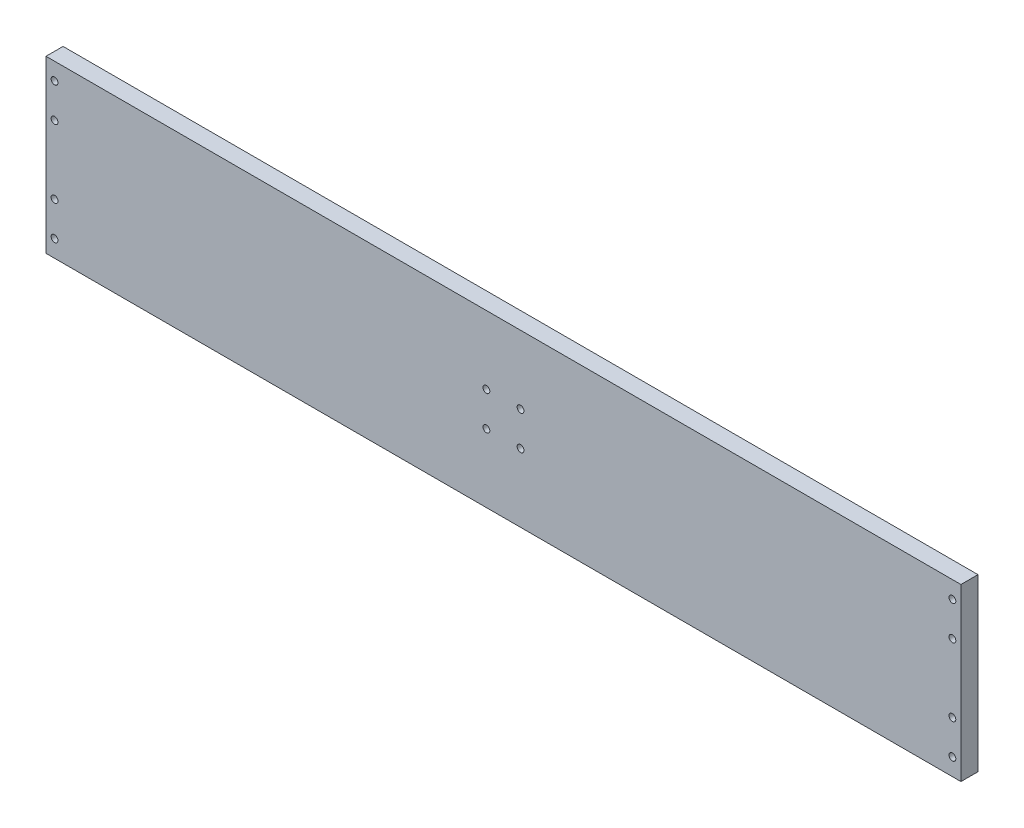
from build123d import *

# Parameters (mm, degrees)
SCHIZZO1_W                   = 536
SCHIZZO1_H                   = 100
SCHIZZO1_R                   = 2
ESTRUSIONE_ESTRUSIONE1_DEPTH = 10
SCHIZZO2_R                   = 2
TAGLIO_ESTRUSIONE1_DEPTH     = 546.340260755


with BuildPart() as part:
    # Schizzo1 → Estrusione-Estrusione1 (new body)
    with BuildSketch(Plane.XY):
        with Locations((268, 50)):
            Rectangle(SCHIZZO1_W, SCHIZZO1_H)
        with Locations((5, 90)):
            Circle(SCHIZZO1_R, mode=Mode.SUBTRACT)
        with Locations((5, 70)):
            Circle(SCHIZZO1_R, mode=Mode.SUBTRACT)
        with Locations((5, 30)):
            Circle(SCHIZZO1_R, mode=Mode.SUBTRACT)
        with Locations((531, 10)):
            Circle(SCHIZZO1_R, mode=Mode.SUBTRACT)
        with Locations((531, 30)):
            Circle(SCHIZZO1_R, mode=Mode.SUBTRACT)
        with Locations((531, 70)):
            Circle(SCHIZZO1_R, mode=Mode.SUBTRACT)
        with Locations((5, 10)):
            Circle(SCHIZZO1_R, mode=Mode.SUBTRACT)
        with Locations((531, 90)):
            Circle(SCHIZZO1_R, mode=Mode.SUBTRACT)
    extrude(amount=-ESTRUSIONE_ESTRUSIONE1_DEPTH)

    # Schizzo2 → Taglio-Estrusione1 (cut, through all)
    with BuildSketch(Plane.XY):
        with Locations((258, 60)):
            Circle(SCHIZZO2_R)
        with Locations((278, 60)):
            Circle(SCHIZZO2_R)
        with Locations((278, 40)):
            Circle(SCHIZZO2_R)
        with Locations((258, 40)):
            Circle(SCHIZZO2_R)
    extrude(amount=-TAGLIO_ESTRUSIONE1_DEPTH, mode=Mode.SUBTRACT)


solid = part.part
